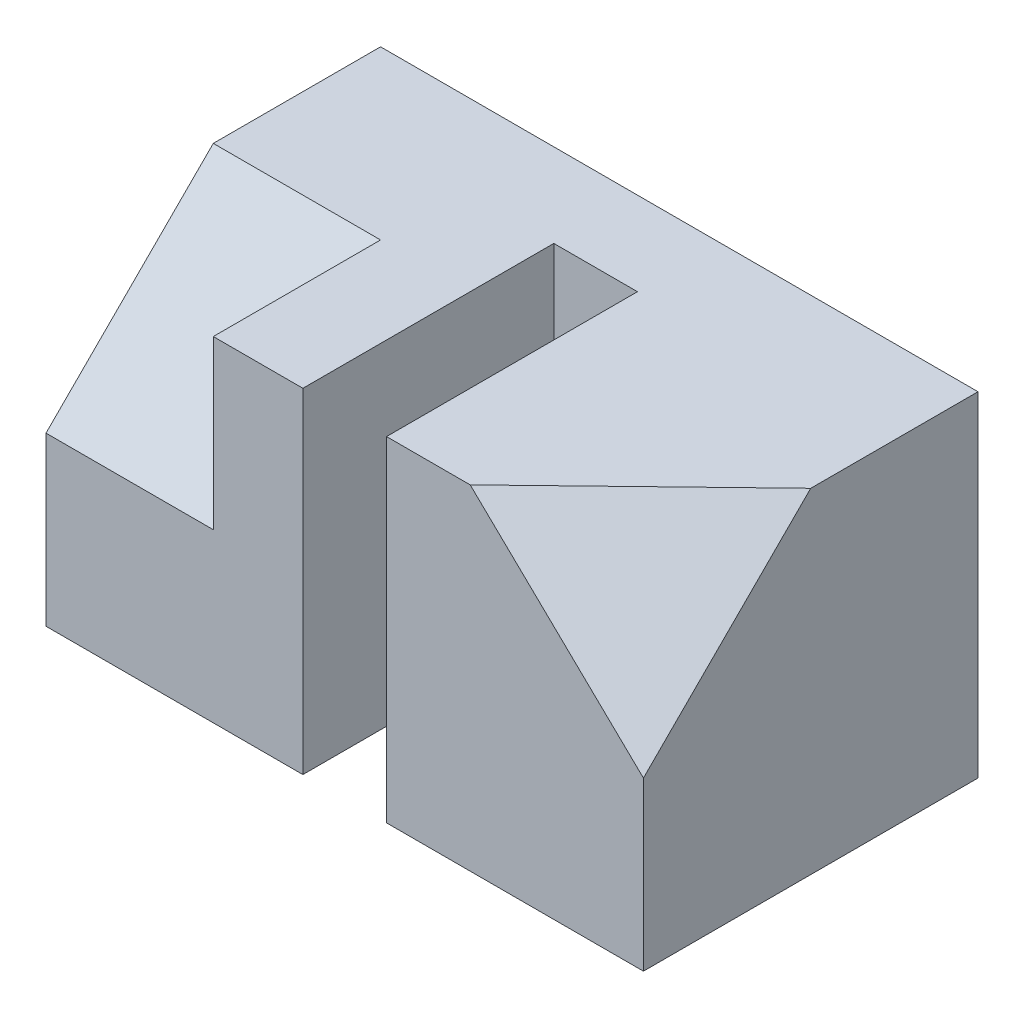
from build123d import *

# Parameters (mm, degrees)
BOSS_EXTRUDE1_DEPTH = 28
CHAMFER1_START      = 34.535646335
CHAMFER1_OUTLINE_W  = 20
CHAMFER1_OUTLINE_H  = 22
CHAMFER1_DEPTH      = 9.464353665
CUT_EXTRUDE1_DEPTH  = 14


with BuildPart() as part:
    # Sketch1 → Boss-Extrude1 (new body)
    with BuildSketch(Plane(origin=(0, 0, 0), x_dir=(1, 0, 0), z_dir=(0, 1, 0))):
        Polygon((0, 0), (0, 7), (25, 7), (25, -21), (3.5, -21), (3.5, 0), align=None)
    extrude(amount=BOSS_EXTRUDE1_DEPTH)

    # Mirror1: part across plane


with BuildPart() as part_1:
    add(part.part)
    add(part.part.mirror(Plane(origin=(0, 28, 0), x_dir=(0, 0, 1), z_dir=(1, 0, 0))))

    # Chamfer1: read off the stored shape, not the designer's step
    # Chamfer1 outline → Chamfer1 (cut)
    with BuildSketch(Plane(origin=(0, 0, 0), x_dir=(0.8258790691262022, -0.39870024026782175, -0.39870024026782164), z_dir=(0.5638472871081651, 0.5839846902191711, 0.583984690219171)).offset(CHAMFER1_START)):
        with Locations((-2, 5)):
            Rectangle(CHAMFER1_OUTLINE_W, CHAMFER1_OUTLINE_H)
    extrude(amount=CHAMFER1_DEPTH, mode=Mode.SUBTRACT)

    # Sketch2 → Cut-Extrude1 (cut)
    with BuildSketch(Plane.ZY.offset(25)):
        Polygon((21, 28), (7, 28), (21, 14), align=None)
    extrude(amount=-CUT_EXTRUDE1_DEPTH, mode=Mode.SUBTRACT)


solid = part_1.part
